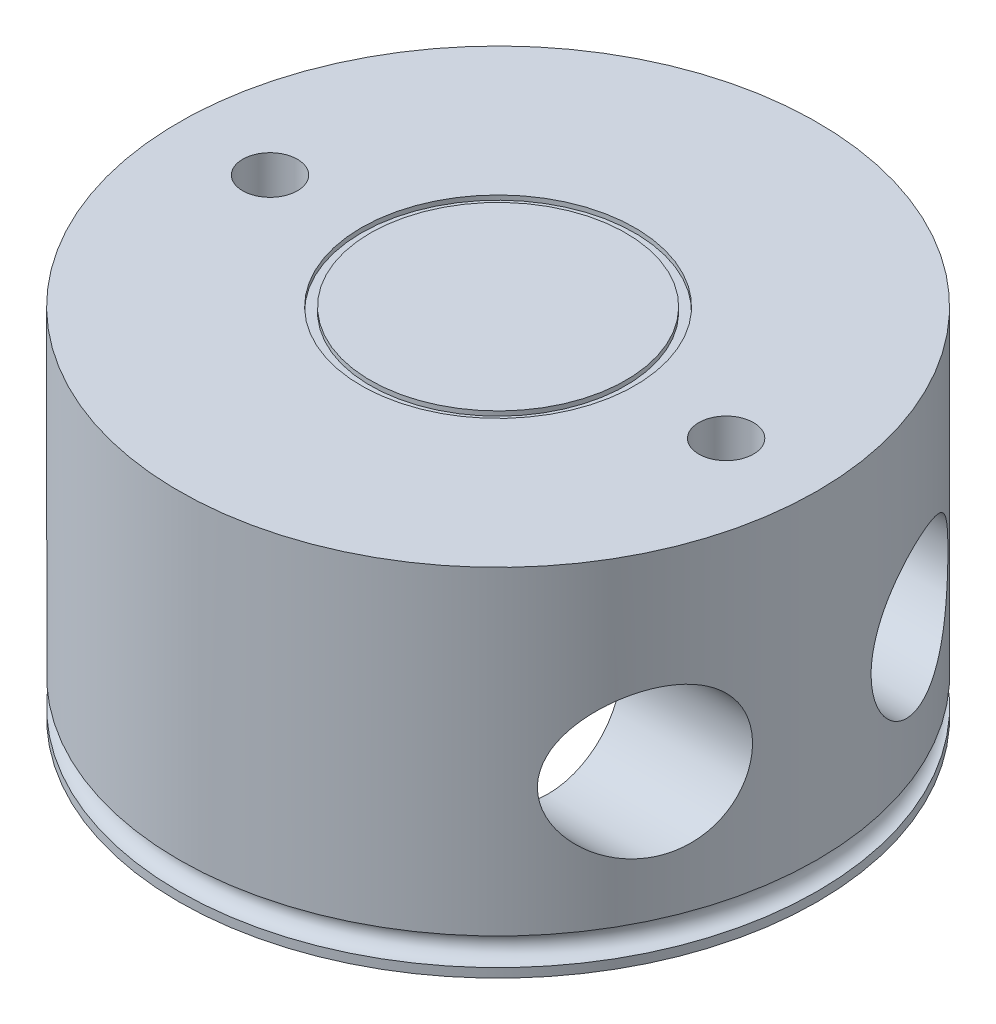
from build123d import *

# Parameters (mm, degrees)
SKETCH2_R           = 35
SKETCH2_R_2         = 33
BOSS_EXTRUDE1_DEPTH = 39
BOSS_EXTRUDE2_START = -2
SKETCH3_R           = 35
BOSS_EXTRUDE2_DEPTH = 2
SKETCH7_R           = 5.5
SKETCH7_R_2         = 1.5
SKETCH7_R_3         = 4
BOSS_EXTRUDE4_DEPTH = 19
SKETCH8_R           = 3
CUT_EXTRUDE3_DEPTH  = 15
CHAMFER1_SIZE       = 3
SKETCH9_R           = 15
SKETCH9_R_2         = 14
CUT_EXTRUDE4_DEPTH  = 0.5
SKETCH10_R          = 1.5
SKETCH11_R          = 8
CUT_EXTRUDE5_DEPTH  = 87.396599101
SKETCH12_R          = 10
SKETCH12_R_2        = 8
BOSS_EXTRUDE5_DEPTH = 15
SKETCH13_R          = 55
SKETCH13_R_2        = 35
CUT_EXTRUDE6_DEPTH  = 64.01587119
FILLET1_R           = 10


with BuildPart() as part:
    # Sketch2 → Boss-Extrude1 (new body)
    with BuildSketch(Plane(origin=(0, 31.812232957, 0), x_dir=(1, 0, 0), z_dir=(0, 1, 0))):
        Circle(SKETCH2_R)
        Circle(SKETCH2_R_2, mode=Mode.SUBTRACT)
    extrude(amount=BOSS_EXTRUDE1_DEPTH)

    # Sketch3 → Boss-Extrude2 (add)
    with BuildSketch(Plane(origin=(0, 70.812232957, 0), x_dir=(1, 0, 0), z_dir=(0, 1, 0)).offset(BOSS_EXTRUDE2_START)):
        Circle(SKETCH3_R)
    extrude(amount=BOSS_EXTRUDE2_DEPTH)

    # Sketch7 → Boss-Extrude4 (add)
    # profile 1 of 2: a face of its own
    with BuildSketch(Plane.XZ.offset(-68.812232957)):
        with Locations(Location((25, 0, 0), (0, 0, 180))):
            Circle(SKETCH7_R)
        with Locations((25, 0)):
            Circle(SKETCH7_R_2, mode=Mode.SUBTRACT)
    # profile 2 of 2: a face of its own
    with BuildSketch(Plane.XZ.offset(-68.812232957)):
        with Locations(Location((-25, 0, 0), (0, 0, 180))):
            Circle(SKETCH7_R_3)
        with Locations((-25, 0)):
            Circle(SKETCH7_R_2, mode=Mode.SUBTRACT)
    extrude(amount=BOSS_EXTRUDE4_DEPTH)

    # Sketch8 → Cut-Extrude3 (cut)
    with BuildSketch(Plane(origin=(0, 70.812232957, 0), x_dir=(1, 0, 0), z_dir=(0, 1, 0))):
        with Locations(Location((25, 0, 0), (0, 0, 180))):
            Circle(SKETCH8_R)
        with Locations(Location((-25, 0, 0), (0, 0, 180))):
            Circle(SKETCH8_R)
    extrude(amount=-CUT_EXTRUDE3_DEPTH, mode=Mode.SUBTRACT)

    # Chamfer1
    # the kernel refuses this chamfer: 3 mm, written as the material it adds along each edge
    with BuildSketch(Plane(origin=(0, 68.812232957, 0), x_dir=(1, 0, 0), z_dir=(0, 0, -1))) as chamfer1_piece_1:
        Polygon((33, CHAMFER1_SIZE), (33 - CHAMFER1_SIZE, 0), (33, 0), align=None)
    revolve(axis=Axis((0, 68.812232957, 0), (0, -1, 0)))

    # Sketch9 → Cut-Extrude4 (cut)
    with BuildSketch(Plane(origin=(0, 70.812232957, 0), x_dir=(1, 0, 0), z_dir=(0, 1, 0))):
        with Locations(Location((0, 0, 0), (0, 0, 180))):
            Circle(SKETCH9_R)
        with Locations(Location((0, 0, 0), (0, 0, 180))):
            Circle(SKETCH9_R_2, mode=Mode.SUBTRACT)
    extrude(amount=-CUT_EXTRUDE4_DEPTH, mode=Mode.SUBTRACT)

    # Sketch10 → Cut-Revolve1 (revolve, cut)
    with BuildSketch(Plane.XY, mode=Mode.PRIVATE) as cut_revolve1_sk:
        with Locations((35, 34.312232957)):
            Circle(SKETCH10_R)
    revolve(cut_revolve1_sk.sketch.rotate(Axis((0, 31.812232957, 0), (0, 1, 0)), 4.795108108), axis=Axis((0, 31.812232957, 0), (0, 1, 0)), mode=Mode.SUBTRACT)

    # Sketch11 → Cut-Extrude5 (cut, through all)
    with BuildSketch(Plane(origin=(0, 0, 0), x_dir=(0, 0, -1), z_dir=(1, 0, 0))):
        with Locations(Location((14.5, 49.812232957, 0), (0, 0, 180))):
            Circle(SKETCH11_R)
        with Locations(Location((-14.5, 49.812232957, 0), (0, 0, 180))):
            Circle(SKETCH11_R)
    extrude(amount=CUT_EXTRUDE5_DEPTH, mode=Mode.SUBTRACT)

    # Sketch12 → Boss-Extrude5 (add)
    # profile 1 of 4: a face of its own
    with BuildSketch(Plane(origin=(20, 0, 0), x_dir=(0, 0, -1), z_dir=(1, 0, 0))):
        with BuildLine():
            Line((-27.5, 70.812232957), (-24.5, 49.812232957))
            ThreePointArc((-24.5, 49.812232957), (-14.5, 59.812232957), (-4.5, 49.812232957))
            Line((-4.5, 49.812232957), (-4.5, 70.812232957))
            Line((-4.5, 70.812232957), (-27.5, 70.812232957))
        make_face()
    # profile 2 of 4: a face of its own
    with BuildSketch(Plane(origin=(20, 0, 0), x_dir=(0, 0, -1), z_dir=(1, 0, 0))):
        with Locations((-14.5, 49.812232957)):
            Circle(SKETCH12_R)
        with Locations((-14.5, 49.812232957)):
            Circle(SKETCH12_R_2, mode=Mode.SUBTRACT)
    # profile 3 of 4: a face of its own
    with BuildSketch(Plane(origin=(20, 0, 0), x_dir=(0, 0, -1), z_dir=(1, 0, 0))):
        with Locations((14.5, 49.812232957)):
            Circle(SKETCH12_R)
        with Locations((14.5, 49.812232957)):
            Circle(SKETCH12_R_2, mode=Mode.SUBTRACT)
    # profile 4 of 4: a face of its own
    with BuildSketch(Plane(origin=(20, 0, 0), x_dir=(0, 0, -1), z_dir=(1, 0, 0))):
        with BuildLine():
            ThreePointArc((4.5, 49.812232957), (14.5, 59.812232957), (24.5, 49.812232957))
            Line((24.5, 49.812232957), (27.5, 70.812232957))
            Line((27.5, 70.812232957), (4.5, 70.812232957))
            Line((4.5, 70.812232957), (4.5, 49.812232957))
        make_face()
    extrude(amount=BOSS_EXTRUDE5_DEPTH)

    # Sketch13 → Cut-Extrude6 (cut, through all)
    with BuildSketch(Plane(origin=(0, 70.812232957, 0), x_dir=(1, 0, 0), z_dir=(0, 1, 0))):
        Circle(SKETCH13_R)
        Circle(SKETCH13_R_2, mode=Mode.SUBTRACT)
    extrude(amount=-CUT_EXTRUDE6_DEPTH, mode=Mode.SUBTRACT)

    # Fillet1
    # the kernel refuses this fillet: 10 mm, written as the material it adds along each edge
    with BuildSketch(Plane(origin=(-25, 68.812232957, 0), x_dir=(-1, 0, 0), z_dir=(0, 0, 1))) as fillet1_piece_1_section:
        with BuildLine():
            CenterArc((4 + FILLET1_R, FILLET1_R), FILLET1_R, 180, 90)
            Line((4 + FILLET1_R, 0), (4, 0))
            Line((4, 0), (4, FILLET1_R))
        make_face()
    fillet1_piece_1 = revolve(axis=Axis((-25, 68.812232957, 0), (0, -1, 0)), mode=Mode.PRIVATE)
    fillet1_piece_1 = fillet1_piece_1 & Plane(origin=(0, 65.946902584, 0), x_dir=(1, 0, 0), z_dir=(0, -1, 0)) * Cylinder(35, 56, mode=Mode.PRIVATE)
    add(fillet1_piece_1)


solid = part.part
